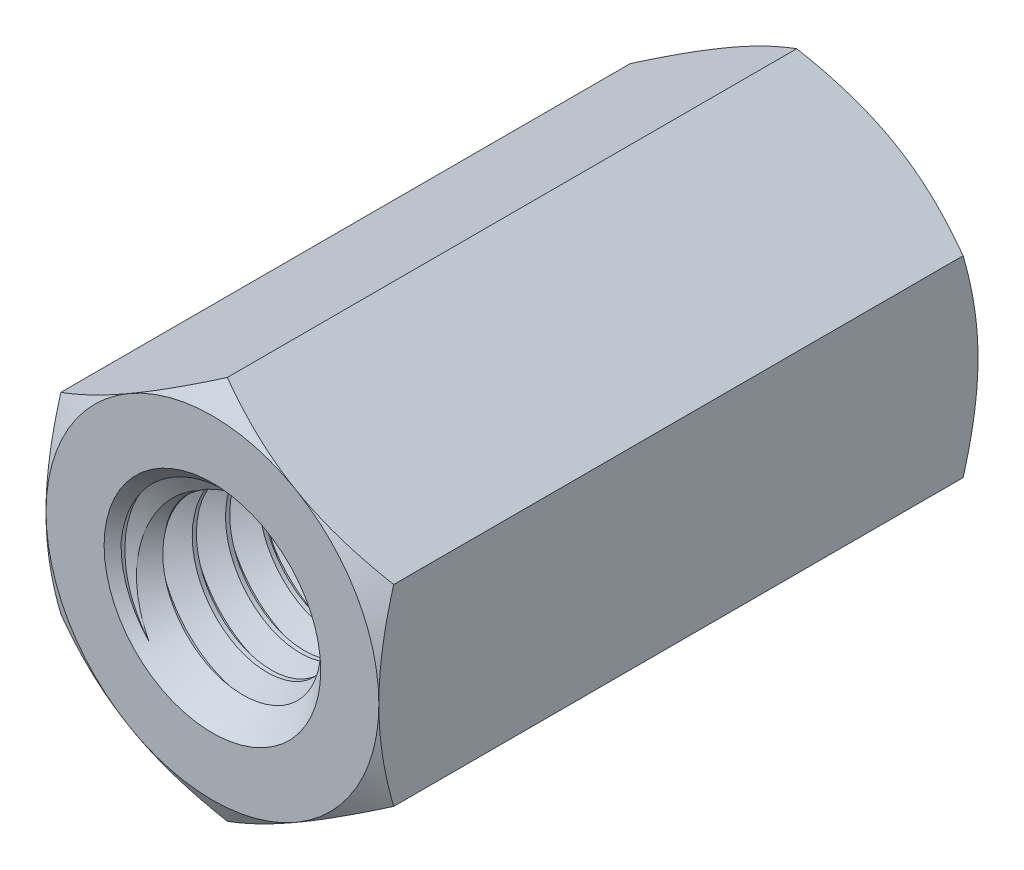
from build123d import *

# Parameters (mm, degrees)
EXTRUDE1_DEPTH     = 18
SKETCH2_OUTSIDE_W  = 87.92
SKETCH2_OUTSIDE_H  = 89.468
SKETCH2_OUTSIDE_R  = 5
CUT_EXTRUDE1_DEPTH = 20.553345835
CUT_EXTRUDE1_DRAFT = -60
SKETCH3_OUTSIDE_W  = 87.92
SKETCH3_OUTSIDE_H  = 89.468
SKETCH3_OUTSIDE_R  = 5
CUT_EXTRUDE2_DEPTH = 20.553345835
CUT_EXTRUDE2_DRAFT = -60
SKETCH4_R          = 3
CUT_EXTRUDE3_DEPTH = 20.553345835
SKETCH12_R         = 3
SKETCH12_R_2       = 2.350480947
EXTRUDE2_DEPTH     = 18
CUT_SWEEP1_PITCH   = 1


with BuildPart() as part:
    # Sketch1 → Extrude1 (new body)
    with BuildSketch(Plane.XY):
        Polygon((0, 5.773502692), (-5, 2.886751346), (-5, -2.886751346), (0, -5.773502692), (5, -2.886751346), (5, 2.886751346), align=None)
    extrude(amount=-EXTRUDE1_DEPTH)


with BuildPart() as cut_extrude1_tool:
    # Sketch2 outside → Cut-Extrude1 (with draft: the straight prism first)
    with BuildSketch(Plane.XY):
        Rectangle(SKETCH2_OUTSIDE_W, SKETCH2_OUTSIDE_H)
        Circle(SKETCH2_OUTSIDE_R, mode=Mode.SUBTRACT)
    extrude(amount=-CUT_EXTRUDE1_DEPTH)
    # Cut-Extrude1: the draft: its side faces are tilted about the plane it starts from
    cut_extrude1_sides = [cut_extrude1_tool.faces().sort_by_distance(p)[0] for p in [
        (0, -44.734, -10.276672917),
        (43.96, 0, -10.276672917),
        (0, 44.734, -10.276672917),
        (-43.96, 0, -10.276672917),
        (-5, 0, -10.276672917),
    ]]
    draft(cut_extrude1_sides, Plane.XY, CUT_EXTRUDE1_DRAFT)


with BuildPart() as part_1:
    add(part.part)

    # Cut-Extrude1: cut by cut_extrude1_tool
    add(cut_extrude1_tool.part, mode=Mode.SUBTRACT)


with BuildPart() as cut_extrude2_tool:
    # Sketch3 outside → Cut-Extrude2 (with draft: the straight prism first)
    with BuildSketch(Plane(origin=(0, 0, -18), x_dir=(-1, 0, 0), z_dir=(0, 0, -1))):
        Rectangle(SKETCH3_OUTSIDE_W, SKETCH3_OUTSIDE_H)
        Circle(SKETCH3_OUTSIDE_R, mode=Mode.SUBTRACT)
    extrude(amount=-CUT_EXTRUDE2_DEPTH)
    # Cut-Extrude2: the draft: its side faces are tilted about the plane it starts from
    cut_extrude2_sides = [cut_extrude2_tool.faces().sort_by_distance(p)[0] for p in [
        (0, -44.734, -7.723327083),
        (-43.96, 0, -7.723327083),
        (0, 44.734, -7.723327083),
        (43.96, 0, -7.723327083),
        (5, 0, -7.723327083),
    ]]
    draft(cut_extrude2_sides, Plane(origin=(0, 0, -18), x_dir=(-1, 0, 0), z_dir=(0, 0, -1)), CUT_EXTRUDE2_DRAFT)


with BuildPart() as part_2:
    add(part_1.part)

    # Cut-Extrude2: cut by cut_extrude2_tool
    add(cut_extrude2_tool.part, mode=Mode.SUBTRACT)

    # Sketch4 → Cut-Extrude3 (cut, through all)
    with BuildSketch(Plane.XY):
        Circle(SKETCH4_R)
    extrude(amount=-CUT_EXTRUDE3_DEPTH, mode=Mode.SUBTRACT)

    # Sketch12 → Extrude2 (add)
    with BuildSketch(Plane.XY):
        Circle(SKETCH12_R)
        Circle(SKETCH12_R_2, mode=Mode.SUBTRACT)
    extrude(amount=-EXTRUDE2_DEPTH)

    # Cut-Sweep1: the profile of Sketch9 profile screwed along a right-hand helix of 19 turns, 6 arcs to a turn; built about Z, then put on its axis
    cut_sweep1_z = Axis((0, 0, 0), (0, 0, 1))
    cut_sweep1_corners = [(3, 0, -0.5), (3, 0, -0.375), (2.350180947, 0, 0.000173205), (2.350180947, 0, -0.875173205)]
    with BuildLine(mode=Mode.PRIVATE) as cut_sweep1_profile:
        Line(cut_sweep1_corners[0], cut_sweep1_corners[1])
        Line(cut_sweep1_corners[1], cut_sweep1_corners[2])
        Line(cut_sweep1_corners[2], cut_sweep1_corners[3])
        Line(cut_sweep1_corners[3], cut_sweep1_corners[0])
    cut_sweep1_cap = Face(cut_sweep1_profile.wire())
    cut_sweep1_turn_angles = [0, 30, 60, 90, 120, 150, 180, 210, 240, 270, 300, 330, 360]
    cut_sweep1_turn_weights = [1, 0.8660254037844387, 1, 0.8660254037844387, 1, 0.8660254037844387, 1, 0.8660254037844387, 1, 0.8660254037844387, 1, 0.8660254037844387, 1]
    cut_sweep1_turn_rails = [Edge.make_bspline([Vector(p[0], p[1], 0).rotate(cut_sweep1_z, cut_sweep1_turn_angles[k]) / cut_sweep1_turn_weights[k] + Vector(0, 0, p[2] + CUT_SWEEP1_PITCH * cut_sweep1_turn_angles[k] / 360) for k in range(13)], [0, 0, 0, 1, 1, 2, 2, 3, 3, 4, 4, 5, 5, 6, 6, 6], 2, cut_sweep1_turn_weights) for p in cut_sweep1_corners]
    cut_sweep1_turn_sides = [Face.make_surface_from_curves(cut_sweep1_turn_rails[p[0]], cut_sweep1_turn_rails[p[1]]) for p in [(0, 1), (1, 2), (2, 3), (3, 0)]]
    cut_sweep1 = Plane(origin=(0, 0, 0), x_dir=(0, 1, 0), z_dir=(0, 0, -1)) * Solid(Shell([*[p.moved(Location((0, 0, CUT_SWEEP1_PITCH * i))) for i in range(19) for p in cut_sweep1_turn_sides], cut_sweep1_cap, cut_sweep1_cap.rotate(cut_sweep1_z, 6840).moved(Location((0, 0, CUT_SWEEP1_PITCH * 6840 / 360)))]))
    add(cut_sweep1, mode=Mode.SUBTRACT)

    # Cut-Extrude6 cone 1 section (through the dimple's axis) → Cut-Extrude6 (revolve, cut)
    with BuildSketch(Plane(origin=(0, 0, 0), x_dir=(0, -1, 0), z_dir=(1, 0, 0))):
        Polygon((0, 0), (3.254, 0), (0, 3.254), align=None)
    revolve(axis=Axis((0, 0, 0), (0, 0, -1)), mode=Mode.SUBTRACT)

    # Cut-Extrude7 cone 1 section (through the dimple's axis) → Cut-Extrude7 (revolve, cut)
    with BuildSketch(Plane(origin=(0, 0, -18), x_dir=(0, 1, 0), z_dir=(1, 0, 0))):
        Polygon((0, 0), (3.254, 0), (0, 3.254), align=None)
    revolve(axis=Axis((0, 0, -18), (0, 0, 1)), mode=Mode.SUBTRACT)


solid = part_2.part
